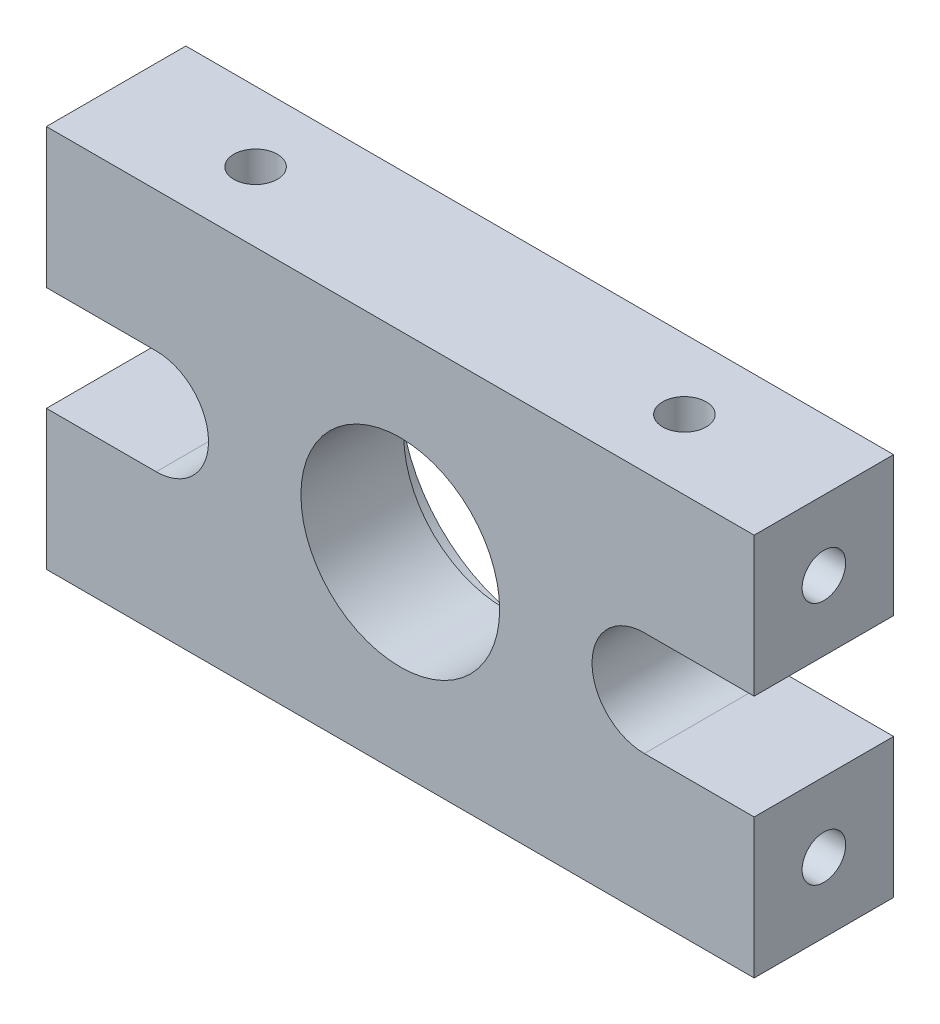
from build123d import *

# Parameters (mm, degrees)
SKETCH1_R                       = 5.7
BOSS_EXTRUDE1_DEPTH             = 8
TAP_DRILL_FOR_M3X0_5_TAP1_D     = 2.5
TAP_DRILL_FOR_M3X0_5_TAP1_DEPTH = 5
TAP_DRILL_FOR_M3X0_5_TAP1_TIP   = 0.751075774
TAP_DRILL_FOR_M3X0_5_TAP2_D     = 2.5
TAP_DRILL_FOR_M3X0_5_TAP2_DEPTH = 5
TAP_DRILL_FOR_M3X0_5_TAP2_TIP   = 0.751075774
TAP_DRILL_FOR_M3X0_5_TAP3_D     = 2.5
TAP_DRILL_FOR_M3X0_5_TAP3_DEPTH = 5
TAP_DRILL_FOR_M3X0_5_TAP3_TIP   = 0.751075774
SKETCH8_R                       = 8
CUT_EXTRUDE1_DEPTH              = 2.1


with BuildPart() as part:
    # Sketch1 → Boss-Extrude1 (new body)
    with BuildSketch(Plane.XY):
        with BuildLine():
            Line((0, 0), (40.6, 0))
            Line((40.6, 0), (40.6, 8))
            Line((40.6, 8), (34.3, 8))
            ThreePointArc((34.3, 8), (31.3, 11), (34.3, 14))
            Line((34.3, 14), (40.6, 14))
            Line((40.6, 14), (40.6, 22))
            Line((40.6, 22), (0, 22))
            Line((0, 22), (0, 14))
            Line((0, 14), (6.3, 14))
            ThreePointArc((6.3, 14), (9.3, 11), (6.3, 8))
            Line((6.3, 8), (0, 8))
            Line((0, 8), (0, 0))
        make_face()
        with Locations((20.3, 11)):
            Circle(SKETCH1_R, mode=Mode.SUBTRACT)
    extrude(amount=BOSS_EXTRUDE1_DEPTH)

    # Tap Drill for M3x0.5 Tap1
    with Locations(Plane(origin=(40.6, 0, 0), x_dir=(0, 0, -1), z_dir=(1, 0, 0))):
        with Locations((-4, 18), (-4, 4)):
            Hole(TAP_DRILL_FOR_M3X0_5_TAP1_D / 2, depth=TAP_DRILL_FOR_M3X0_5_TAP1_DEPTH)
            with Locations((0, 0, -(TAP_DRILL_FOR_M3X0_5_TAP1_DEPTH + TAP_DRILL_FOR_M3X0_5_TAP1_TIP / 2))):  # 118° drill point
                Cone(0, TAP_DRILL_FOR_M3X0_5_TAP1_D / 2, TAP_DRILL_FOR_M3X0_5_TAP1_TIP, mode=Mode.SUBTRACT)

    # Tap Drill for M3x0.5 Tap2
    with Locations(Plane.ZY):
        with Locations((4, 4), (4, 18)):
            Hole(TAP_DRILL_FOR_M3X0_5_TAP2_D / 2, depth=TAP_DRILL_FOR_M3X0_5_TAP2_DEPTH)
            with Locations((0, 0, -(TAP_DRILL_FOR_M3X0_5_TAP2_DEPTH + TAP_DRILL_FOR_M3X0_5_TAP2_TIP / 2))):  # 118° drill point
                Cone(0, TAP_DRILL_FOR_M3X0_5_TAP2_D / 2, TAP_DRILL_FOR_M3X0_5_TAP2_TIP, mode=Mode.SUBTRACT)

    # Tap Drill for M3x0.5 Tap3
    with Locations(Plane(origin=(0, 22, 0), x_dir=(1, 0, 0), z_dir=(0, 1, 0))):
        with Locations((32.6, -4), (8, -4)):
            Hole(TAP_DRILL_FOR_M3X0_5_TAP3_D / 2, depth=TAP_DRILL_FOR_M3X0_5_TAP3_DEPTH)
            with Locations((0, 0, -(TAP_DRILL_FOR_M3X0_5_TAP3_DEPTH + TAP_DRILL_FOR_M3X0_5_TAP3_TIP / 2))):  # 118° drill point
                Cone(0, TAP_DRILL_FOR_M3X0_5_TAP3_D / 2, TAP_DRILL_FOR_M3X0_5_TAP3_TIP, mode=Mode.SUBTRACT)

    # Sketch8 → Cut-Extrude1 (cut)
    with BuildSketch(Plane(origin=(0, 0, 0), x_dir=(-1, 0, 0), z_dir=(0, 0, -1))):
        with Locations((-20.3, 11)):
            Circle(SKETCH8_R)
    extrude(amount=-CUT_EXTRUDE1_DEPTH, mode=Mode.SUBTRACT)


solid = part.part
